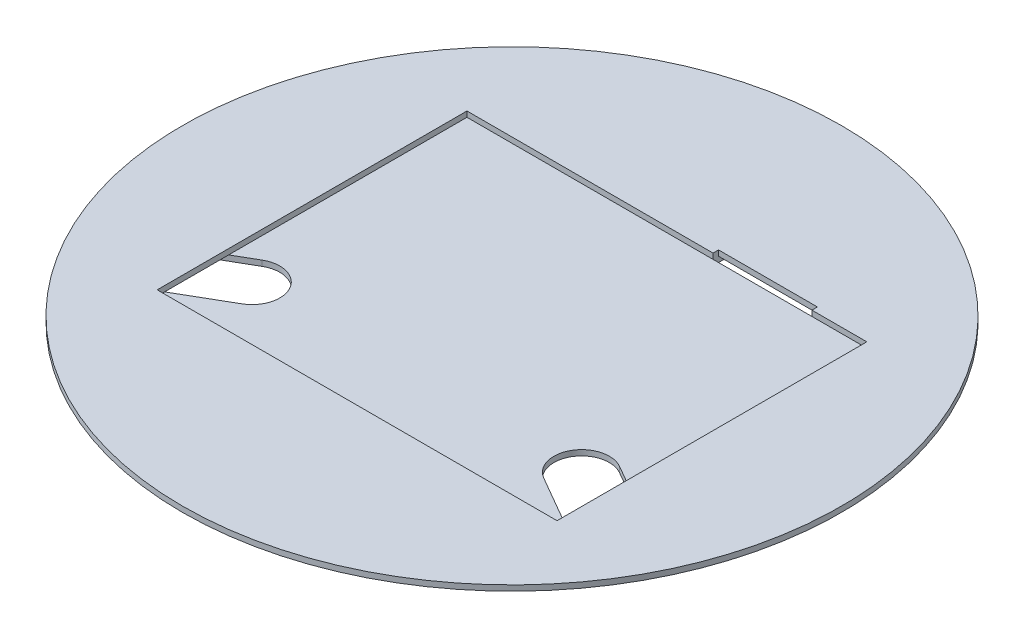
from build123d import *

# Parameters (mm, degrees)
SKETCH1_R           = 150
BOSS_EXTRUDE1_DEPTH = 5
SKETCH4_W           = 182
SKETCH4_H           = 141
CUT_EXTRUDE2_DEPTH  = 2.5
SKETCH6_R           = 150
CUT_EXTRUDE3_DEPTH  = 2.5
SKETCH9_W           = 45
SKETCH9_H           = 2.5
CUT_EXTRUDE10_DEPTH = 2.5
SKETCH10_W          = 45
SKETCH10_H          = 10
CUT_EXTRUDE11_DEPTH = 2.5


with BuildPart() as part:
    # Sketch1 → Boss-Extrude1 (new body)
    with BuildSketch(Plane(origin=(0, 0, 0), x_dir=(1, 0, 0), z_dir=(0, 1, 0))):
        Circle(SKETCH1_R)
    extrude(amount=BOSS_EXTRUDE1_DEPTH)

    # Sketch4 → Cut-Extrude2 (cut)
    with BuildSketch(Plane(origin=(0, 5, 0), x_dir=(1, 0, 0), z_dir=(0, 1, 0))):
        Rectangle(SKETCH4_W, SKETCH4_H)
    extrude(amount=-CUT_EXTRUDE2_DEPTH, mode=Mode.SUBTRACT)

    # Sketch6 → Cut-Extrude3 (cut)
    with BuildSketch(Plane(origin=(0, 0, 0), x_dir=(-1, 0, 0), z_dir=(0, -1, 0))):
        Circle(SKETCH6_R)
        with BuildLine():
            Line((-12.624999819, 86.600402105), (-12.63043937, 118.717124445))
            ThreePointArc((-12.63043937, 118.717124445), (-14.319945193, 122.406590402), (-18.216597772, 123.539148413))
            ThreePointArc((-18.216597772, 123.539148413), (-108.144922298, 62.4375), (-116.096339773, -45.993537766))
            ThreePointArc((-116.096339773, -45.993537766), (-113.167189475, -48.801858883), (-109.127265319, -48.420280867))
            Line((-109.127265319, -48.420280867), (-81.31064811, -32.366630487))
            ThreePointArc((-81.31064811, -32.366630487), (-64.066429277, -36.988770189), (-68.685648291, -54.233771618))
            Line((-68.685648291, -54.233771618), (-96.496825949, -70.296843578))
            ThreePointArc((-96.496825949, -70.296843578), (-98.847244283, -73.604731519), (-97.879742002, -77.545610647))
            ThreePointArc((-97.879742002, -77.545610647), (0, -124.875), (97.879742002, -77.545610647))
            ThreePointArc((97.879742002, -77.545610647), (98.847244283, -73.604731519), (96.496825949, -70.296843578))
            Line((96.496825949, -70.296843578), (68.685648291, -54.233771618))
            ThreePointArc((68.685648291, -54.233771618), (64.066429277, -36.988770189), (81.31064811, -32.366630487))
            Line((81.31064811, -32.366630487), (109.127265319, -48.420280867))
            ThreePointArc((109.127265319, -48.420280867), (113.167189475, -48.801858883), (116.096339773, -45.993537766))
            ThreePointArc((116.096339773, -45.993537766), (108.144922298, 62.4375), (18.216597772, 123.539148413))
            ThreePointArc((18.216597772, 123.539148413), (14.319945193, 122.406590402), (12.63043937, 118.717124445))
            Line((12.63043937, 118.717124445), (12.624999819, 86.600402105))
            ThreePointArc((12.624999819, 86.600402105), (0, 73.977540378), (-12.624999819, 86.600402105))
        make_face(mode=Mode.SUBTRACT)
    extrude(amount=-CUT_EXTRUDE3_DEPTH, mode=Mode.SUBTRACT)

    # Sketch9 → Cut-Extrude10 (cut)
    with BuildSketch(Plane(origin=(0, 5, 0), x_dir=(1, 0, 0), z_dir=(0, 1, 0))):
        with Locations((43.5, 71.75)):
            Rectangle(SKETCH9_W, SKETCH9_H)
    extrude(amount=-CUT_EXTRUDE10_DEPTH, mode=Mode.SUBTRACT)

    # Sketch10 → Cut-Extrude11 (cut)
    with BuildSketch(Plane.XZ):
        with Locations((43.5, -75.5)):
            Rectangle(SKETCH10_W, SKETCH10_H)
    extrude(amount=-CUT_EXTRUDE11_DEPTH, mode=Mode.SUBTRACT)


solid = part.part
